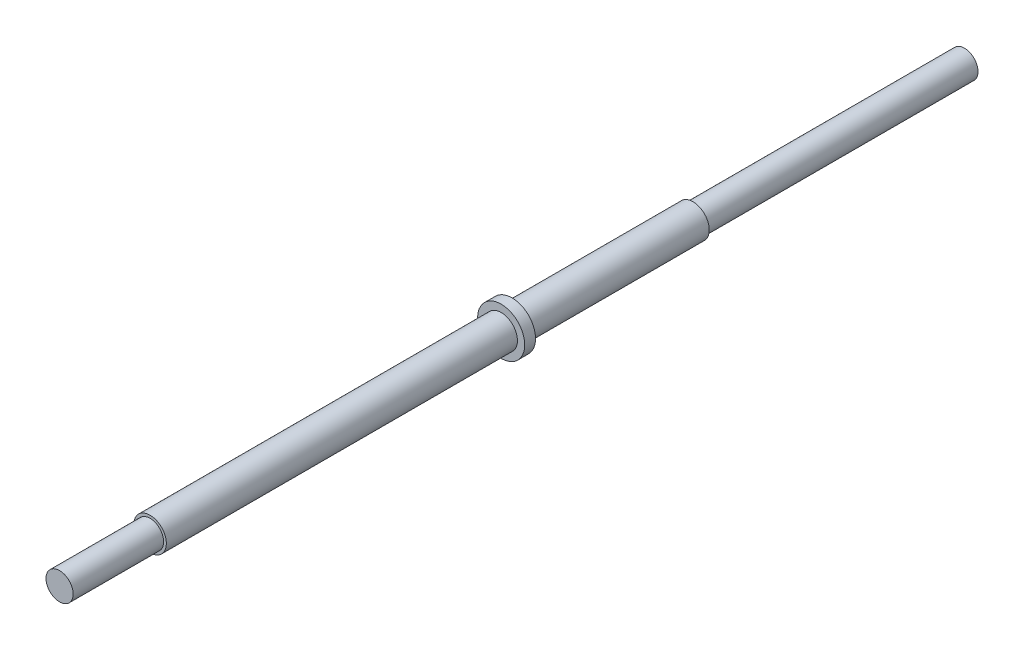
from build123d import *

# Parameters (mm, degrees)
SKETCH1_R           = 4.5
BOSS_EXTRUDE1_DEPTH = 250
SKETCH5_W           = 0.75
SKETCH5_H           = 75
SKETCH13_W          = 3
SKETCH13_H          = 2
SKETCH14_W          = 0.75
SKETCH14_H          = 25


with BuildPart() as part:
    # Sketch1 → Boss-Extrude1 (new body)
    with BuildSketch(Plane.XY):
        Circle(SKETCH1_R)
    extrude(amount=BOSS_EXTRUDE1_DEPTH)

    # Sketch5 → Cut-Revolve1 (revolve, cut)
    with BuildSketch(Plane(origin=(0, 0, 0), x_dir=(1, 0, 0), z_dir=(0, 1, 0))):
        with Locations((4.125, -37.5)):
            Rectangle(SKETCH5_W, SKETCH5_H)
    revolve(axis=Axis((0, 0, 0), (0, 0, 1)), mode=Mode.SUBTRACT)

    # Sketch14 → Cut-Revolve2 (revolve, cut)
    with BuildSketch(Plane(origin=(0, 0, 0), x_dir=(1, 0, 0), z_dir=(0, 1, 0))):
        with Locations((4.125, -237.5)):
            Rectangle(SKETCH14_W, SKETCH14_H)
    revolve(axis=Axis((0, 0, 0), (0, 0, 1)), mode=Mode.SUBTRACT)


with BuildPart() as body_2:
    # Sketch13 → Revolve2 (revolve)
    with BuildSketch(Plane(origin=(0, 0, 0), x_dir=(0, 0, -1), z_dir=(1, 0, 0))):
        with Locations((-126.5, 5.500488183)):
            Rectangle(SKETCH13_W, SKETCH13_H)
    revolve(axis=Axis((0, 0, 0), (0, 0, 1)))


solid = Compound([part.part, body_2.part])
